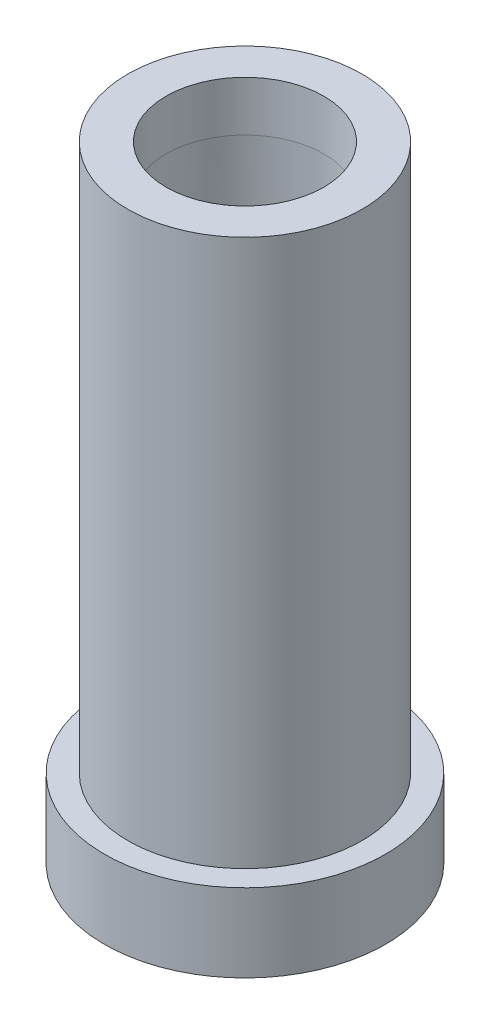
from build123d import *

# Parameters (mm, degrees)
CUT_EXTRUDE1_REACH = 43.976
SKETCH2_R          = 5.05


with BuildPart() as part:
    # Sketch1 → Revolve1 (revolve)
    with BuildSketch(Plane.XY):
        Polygon((0, 0), (9, 0), (9, 5), (7.5, 5), (7.5, 40), (0, 40), align=None)
    revolve(axis=Axis((0, 45, 0), (0, -1, 0)))

    # Sketch2 → Cut-Extrude1 (cut, up to next)
    with BuildSketch(Plane(origin=(0, 40, 0), x_dir=(1, 0, 0), z_dir=(0, 1, 0)), mode=Mode.PRIVATE) as cut_extrude1_sk1:
        Circle(SKETCH2_R)
    cut_extrude1_tool1 = extrude(cut_extrude1_sk1.sketch, amount=-CUT_EXTRUDE1_REACH, mode=Mode.PRIVATE) & part.part
    add(cut_extrude1_tool1.solids().sort_by_distance((0, 40, 0))[0], mode=Mode.SUBTRACT)

    # Cut-Sweep1: sweep along a path in Sketch4
    with BuildLine(Plane(origin=(0, 40, 0), x_dir=(1, 0, 0), z_dir=(0, 1, 0))) as cut_sweep1_path:
        CenterArc((0, 0), 5.05, 0, 360)
    # Sketch3 → Cut-Sweep1 (sweep, cut)
    with BuildSketch(Plane.XY):
        Polygon((5.05, 36.8), (6.013641914, 0), (5.05, 0), align=None)
    sweep(path=cut_sweep1_path.line, mode=Mode.SUBTRACT)


solid = part.part
